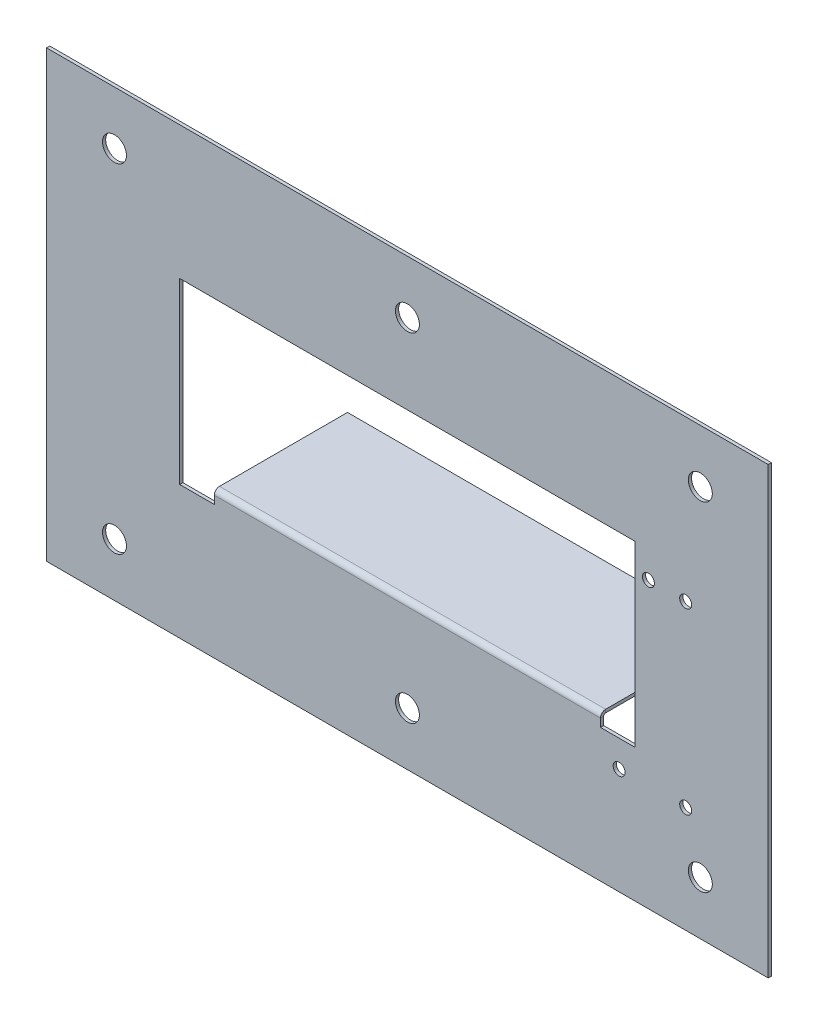
from build123d import *

# Parameters (mm, degrees)
SKETCH_1_W             = 271
SKETCH_1_H             = 167
SKETCH_1_R             = 2.25
SM_BASE_FLANGE_1_DEPTH = 1.2
SM_EDGE_FLANGE_1_DEPTH = 145
CUT_EXTRUDE_1_REACH    = 255.647
SKETCH_9_R             = 4.5


# Sheet-metal steps are written as plain solids
with BuildPart() as part:
    # Sketch 1 → Базовая кромка1 (new body)
    with BuildSketch(Plane.XY):
        with Locations((85.5, 30.5)):
            Rectangle(SKETCH_1_W, SKETCH_1_H)
        with Locations((176, 53.9366)):
            Circle(SKETCH_1_R, mode=Mode.SUBTRACT)
        with Locations((190, 53.9366)):
            Circle(SKETCH_1_R, mode=Mode.SUBTRACT)
        with Locations((165, -13.0634)):
            Circle(SKETCH_1_R, mode=Mode.SUBTRACT)
        with Locations((190, -13.0634)):
            Circle(SKETCH_1_R, mode=Mode.SUBTRACT)
        Polygon((13, 0), (158, 0), (158, -3), (171, -3), (171, 0), (171, 64), (0, 64), (0, 0), (0, -3), (13, -3), align=None, mode=Mode.SUBTRACT)
    extrude(amount=-SM_BASE_FLANGE_1_DEPTH)

    # Ребро-кромка1 section (across the edge) → Ребро-кромка1 (add)
    with BuildSketch(Plane(origin=(13, 0.7366, -1.2), x_dir=(0, -1, 0), z_dir=(1, 0, 0))):
        with BuildLine():
            Line((-1.2, 0.7366), (-1.2, 48.8))
            Line((-1.2, 48.8), (0, 48.8))
            Line((0, 48.8), (0, 0.7366))
            ThreePointArc((0, 0.7366), (0.215745145, 0.215745145), (0.7366, 0))
            Line((0.7366, 0), (0.7366, -1.2))
            ThreePointArc((0.7366, -1.2), (-0.632782992, -0.632782992), (-1.2, 0.7366))
        make_face()
    extrude(amount=SM_EDGE_FLANGE_1_DEPTH)

    # Эскиз9 → Вырез-Вытянуть1 (cut, up to next)
    with BuildSketch(Plane.XY, mode=Mode.PRIVATE) as cut_extrude_1_sk1:
        with Locations((-24.5, 94)):
            Circle(SKETCH_9_R)
    cut_extrude_1_tool1 = extrude(cut_extrude_1_sk1.sketch, amount=-CUT_EXTRUDE_1_REACH, mode=Mode.PRIVATE) & part.part
    # Эскиз9 → Вырез-Вытянуть1 (cut, up to next)
    with BuildSketch(Plane.XY, mode=Mode.PRIVATE) as cut_extrude_1_sk2:
        with Locations((-24.5, -33)):
            Circle(SKETCH_9_R)
    cut_extrude_1_tool2 = extrude(cut_extrude_1_sk2.sketch, amount=-CUT_EXTRUDE_1_REACH, mode=Mode.PRIVATE) & part.part
    # Эскиз9 → Вырез-Вытянуть1 (cut, up to next)
    with BuildSketch(Plane.XY, mode=Mode.PRIVATE) as cut_extrude_1_sk3:
        with Locations((85.5, -33)):
            Circle(SKETCH_9_R)
    cut_extrude_1_tool3 = extrude(cut_extrude_1_sk3.sketch, amount=-CUT_EXTRUDE_1_REACH, mode=Mode.PRIVATE) & part.part
    # Эскиз9 → Вырез-Вытянуть1 (cut, up to next)
    with BuildSketch(Plane.XY, mode=Mode.PRIVATE) as cut_extrude_1_sk4:
        with Locations((85.5, 94)):
            Circle(SKETCH_9_R)
    cut_extrude_1_tool4 = extrude(cut_extrude_1_sk4.sketch, amount=-CUT_EXTRUDE_1_REACH, mode=Mode.PRIVATE) & part.part
    # Эскиз9 → Вырез-Вытянуть1 (cut, up to next)
    with BuildSketch(Plane.XY, mode=Mode.PRIVATE) as cut_extrude_1_sk5:
        with Locations((195.5, 94)):
            Circle(SKETCH_9_R)
    cut_extrude_1_tool5 = extrude(cut_extrude_1_sk5.sketch, amount=-CUT_EXTRUDE_1_REACH, mode=Mode.PRIVATE) & part.part
    # Эскиз9 → Вырез-Вытянуть1 (cut, up to next)
    with BuildSketch(Plane.XY, mode=Mode.PRIVATE) as cut_extrude_1_sk6:
        with Locations((195.5, -33)):
            Circle(SKETCH_9_R)
    cut_extrude_1_tool6 = extrude(cut_extrude_1_sk6.sketch, amount=-CUT_EXTRUDE_1_REACH, mode=Mode.PRIVATE) & part.part
    add(cut_extrude_1_tool1.solids().sort_by_distance((-24.5, 94, 0))[0], mode=Mode.SUBTRACT)
    add(cut_extrude_1_tool2.solids().sort_by_distance((-24.5, -33, 0))[0], mode=Mode.SUBTRACT)
    add(cut_extrude_1_tool3.solids().sort_by_distance((85.5, -33, 0))[0], mode=Mode.SUBTRACT)
    add(cut_extrude_1_tool4.solids().sort_by_distance((85.5, 94, 0))[0], mode=Mode.SUBTRACT)
    add(cut_extrude_1_tool5.solids().sort_by_distance((195.5, 94, 0))[0], mode=Mode.SUBTRACT)
    add(cut_extrude_1_tool6.solids().sort_by_distance((195.5, -33, 0))[0], mode=Mode.SUBTRACT)


solid = part.part
